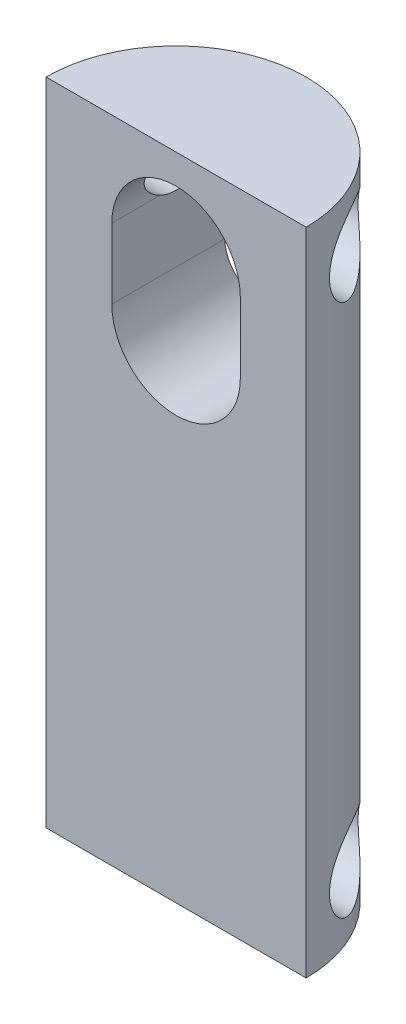
from build123d import *

# Parameters (mm, degrees)
SKETCH1_W           = 20
SKETCH1_H           = 10
BOSS_EXTRUDE1_DEPTH = 50
SKETCH2_R           = 3
CUT_EXTRUDE1_DEPTH  = 55.083269132
CUT_EXTRUDE2_DEPTH  = 14
LPATTERN1_COUNT     = 2
LPATTERN1_PITCH     = 41
FILLET1_DEPTH       = 50


with BuildPart() as part:
    # Sketch1 → Boss-Extrude1 (new body)
    with BuildSketch(Plane(origin=(0, 0, 0), x_dir=(1, 0, 0), z_dir=(0, 1, 0))):
        Rectangle(SKETCH1_W, SKETCH1_H)
    extrude(amount=BOSS_EXTRUDE1_DEPTH)

    # Sketch2 → Cut-Extrude1 (cut, through all)
    with BuildSketch(Plane(origin=(10, 0, 0), x_dir=(0, 0, -1), z_dir=(1, 0, 0))):
        with Locations((0, 4.509775146)):
            Circle(SKETCH2_R)
    cut_extrude1 = extrude(amount=-CUT_EXTRUDE1_DEPTH, mode=Mode.SUBTRACT)

    # Sketch3 → Cut-Extrude2 (cut)
    with BuildSketch(Plane(origin=(0, 0, -5), x_dir=(-1, 0, 0), z_dir=(0, 0, -1))):
        with BuildLine():
            Line((-4.941150344, 37.404706109), (-4.941150344, 42.795051939))
            ThreePointArc((-4.941150344, 42.795051939), (0, 47.736202283), (4.941150344, 42.795051939))
            Line((4.941150344, 42.795051939), (4.941150344, 37.404706109))
            ThreePointArc((4.941150344, 37.404706109), (0, 32.463555765), (-4.941150344, 37.404706109))
        make_face()
    extrude(amount=-CUT_EXTRUDE2_DEPTH, mode=Mode.SUBTRACT)

    # LPattern1: Cut-Extrude1 ×2
    with Locations(*[(0, i * LPATTERN1_PITCH, 0) for i in range(1, LPATTERN1_COUNT)]):
        add(cut_extrude1, mode=Mode.SUBTRACT)

    # Fillet1: read off the stored shape, not the designer's step
    # Fillet1 outline → Fillet1 (cut)
    with BuildSketch(Plane(origin=(0, 0, 0), x_dir=(1, 0, 0), z_dir=(0, 1, 0))):
        with BuildLine():
            ThreePointArc((0, 5), (7.071067812, 2.071067812), (10, -5))
            Line((10, -5), (10, 5))
            Line((10, 5), (0, 5))
        make_face()
        with BuildLine():
            Line((0, 5), (-10, 5))
            Line((-10, 5), (-10, -5))
            ThreePointArc((-10, -5), (-7.071067812, 2.071067812), (0, 5))
        make_face()
    extrude(amount=FILLET1_DEPTH, mode=Mode.SUBTRACT)


solid = part.part
